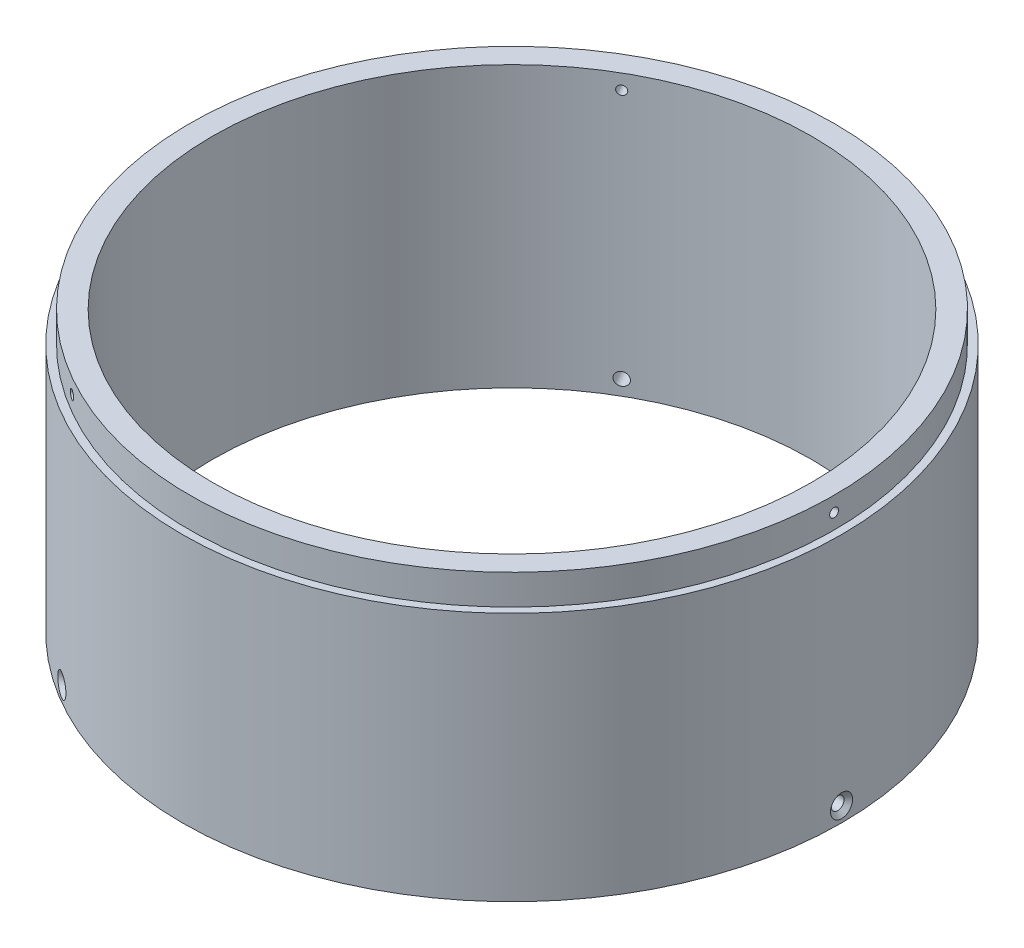
from build123d import *

# Parameters (mm, degrees)
F_4_40_TAPPED_HOLE1_REACH  = 199.542
F_4_40_TAPPED_HOLE1_BORE_R = 1.1303
CIRPATTERN1_COUNT          = 3


# Read off the part's stored shape, not the designer's step: CSK for #4 Flat Head Machine Screw (100)1
with BuildPart() as part:
    # Sketch1 → Revolve1 (revolve)
    with BuildSketch(Plane.XY, mode=Mode.PRIVATE) as revolve1_sk:
        Polygon((-76.2, 0), (-81.8896, 0), (-81.8896, -7.6708), (-83.82, -7.6708), (-83.82, -71.1708), (-76.2, -71.1708), align=None)
    revolve(revolve1_sk.sketch.rotate(Axis((0, 0, 0), (0, 1, 0)), 270), axis=Axis((0, 0, 0), (0, 1, 0)))

    # #4-40 Tapped Hole1 bore (on position points) → #4-40 Tapped Hole1 (cut, up to next)
    with BuildSketch(Plane(origin=(81.8896, -3.81, 0), x_dir=(0, 0, 1), z_dir=(1, 0, 0)), mode=Mode.PRIVATE) as f_4_40_tapped_hole1_sk1:
        Circle(F_4_40_TAPPED_HOLE1_BORE_R)
    f_4_40_tapped_hole1_tool1 = extrude(f_4_40_tapped_hole1_sk1.sketch, amount=-F_4_40_TAPPED_HOLE1_REACH, mode=Mode.PRIVATE) & part.part
    f_4_40_tapped_hole1 = f_4_40_tapped_hole1_tool1.solids().sort_by_distance((81.8896, -3.81, 0))[0]
    add(f_4_40_tapped_hole1, mode=Mode.SUBTRACT)

    # CSK for _4 Flat Head Machine Screw _ 2 → CSK for #4 Flat Head Machine Screw (100)1 (revolve, cut)
    with BuildSketch(Plane(origin=(0, -67.3608, 0), x_dir=(0, 1, 0), z_dir=(0, 0, -1))):
        Polygon((2.857519918, 83.820016713), (0, 83.820016713), (0, 76.182513139), (1.63195, 76.182513139), (1.63195, 82.791641447), align=None)
    csk_for_4_flat_head_machine_screw_100 = revolve(axis=Axis((0, -67.3608, 0), (1, 0, 0)), mode=Mode.SUBTRACT)

    # CirPattern1: #4-40 Tapped Hole1, CSK for #4 Flat Head Machine Screw (100)1 ×3 about axis
    cirpattern1_axis = Axis((0, 0, 0), (0, -1, 0))
    add([f_4_40_tapped_hole1.rotate(cirpattern1_axis, i * 360 / CIRPATTERN1_COUNT) for i in range(1, CIRPATTERN1_COUNT)], mode=Mode.SUBTRACT)
    add([csk_for_4_flat_head_machine_screw_100.rotate(cirpattern1_axis, i * 360 / CIRPATTERN1_COUNT) for i in range(1, CIRPATTERN1_COUNT)], mode=Mode.SUBTRACT)


solid = part.part
